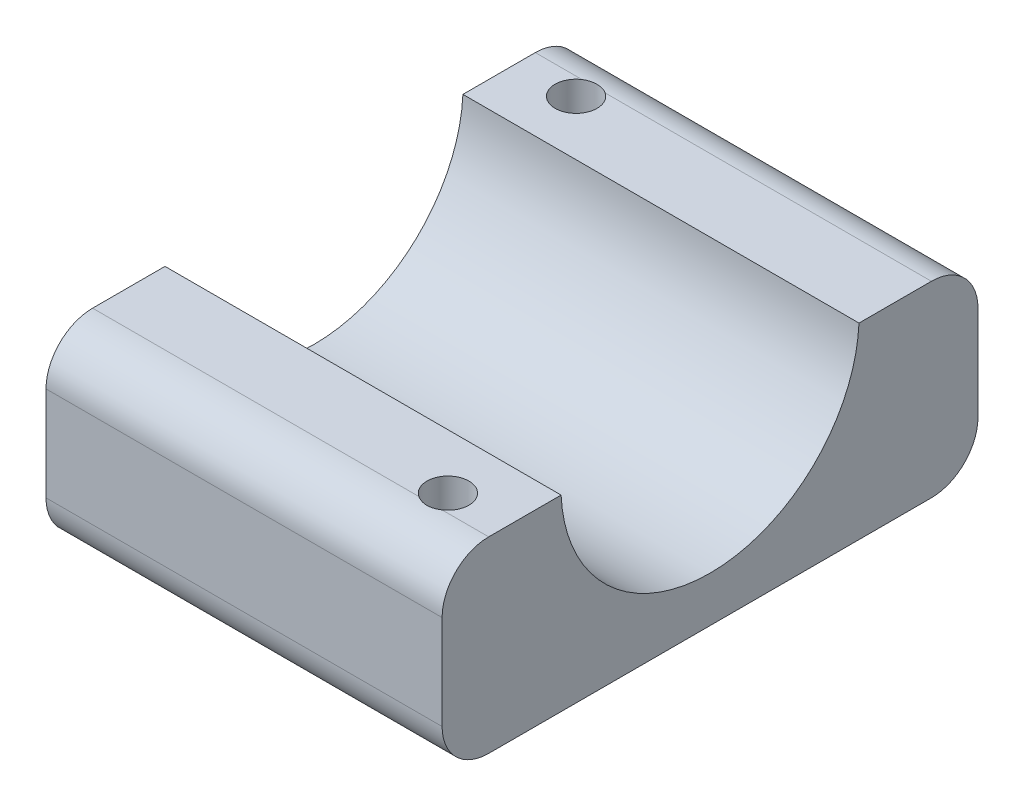
from build123d import *

# Parameters (mm, degrees)
BOSS_EXTRUDE1_DEPTH     = 17
CUT_EXTRUDE1_DEPTH      = 34.119329703
CUT_EXTRUDE1_DEPTH_BACK = 34.119329703
SKETCH2_R               = 12.8
SKETCH3_R               = 1.8
CUT_EXTRUDE2_DEPTH      = 17
SKETCH4_R               = 3.25
CUT_EXTRUDE3_DEPTH      = 4.3


with BuildPart() as part:
    # Sketch1 → Boss-Extrude1 (new, symmetric)
    with BuildSketch(Plane(origin=(0, 0, 0), x_dir=(0, 0, -1), z_dir=(1, 0, 0))):
        with BuildLine():
            Line((-19, -16.7), (19, -16.7))
            ThreePointArc((19, -16.7), (21.828427125, -15.528427125), (23, -12.7))
            Line((23, -12.7), (23, -4.6))
            ThreePointArc((23, -4.6), (21.828427125, -1.771572875), (19, -0.6))
            Line((19, -0.6), (-19, -0.6))
            ThreePointArc((-19, -0.6), (-21.828427125, -1.771572875), (-23, -4.6))
            Line((-23, -4.6), (-23, -12.7))
            ThreePointArc((-23, -12.7), (-21.828427125, -15.528427125), (-19, -16.7))
        make_face()
    extrude(amount=BOSS_EXTRUDE1_DEPTH, both=True)

    # Sketch2 → Cut-Extrude1 (cut, two sides: drawn at the far end of the back side and taken through both)
    with BuildSketch(Plane(origin=(0, 0, 0), x_dir=(0, 0, -1), z_dir=(1, 0, 0)).offset(-CUT_EXTRUDE1_DEPTH_BACK)):
        Circle(SKETCH2_R)
    extrude(amount=CUT_EXTRUDE1_DEPTH + CUT_EXTRUDE1_DEPTH_BACK, mode=Mode.SUBTRACT)

    # Sketch3 → Cut-Extrude2 (cut)
    with BuildSketch(Plane(origin=(0, -16.7, 0), x_dir=(1, 0, 0), z_dir=(0, 1, 0))):
        with Locations((12, -17.5)):
            Circle(SKETCH3_R)
        with Locations((-12, 17.5)):
            Circle(SKETCH3_R)
    extrude(amount=CUT_EXTRUDE2_DEPTH, mode=Mode.SUBTRACT)

    # Sketch4 → Cut-Extrude3 (cut)
    with BuildSketch(Plane(origin=(0, -16.7, 0), x_dir=(1, 0, 0), z_dir=(0, 1, 0))):
        with Locations((12, -17.5)):
            Circle(SKETCH4_R)
        with Locations((-12, 17.5)):
            Circle(SKETCH4_R)
    extrude(amount=CUT_EXTRUDE3_DEPTH, mode=Mode.SUBTRACT)


solid = part.part
